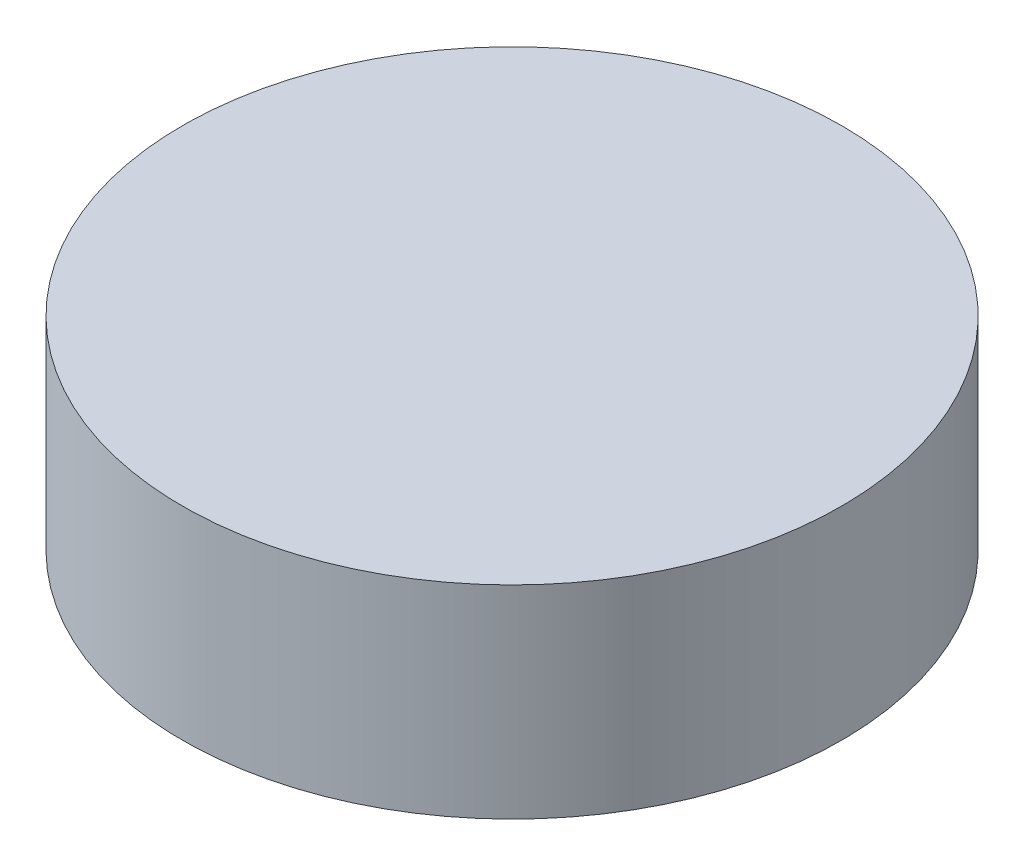
from build123d import *

# Parameters (mm, degrees)
SKETCH_1_W = 6.5
SKETCH_1_H = 4


with BuildPart() as part:
    # 草图1 → Revolve 2 (revolve)
    with BuildSketch(Plane.XY):
        with Locations((3.25, 2)):
            Rectangle(SKETCH_1_W, SKETCH_1_H)
    revolve(axis=Axis((0, 0, 0), (0, 1, 0)))


solid = part.part
